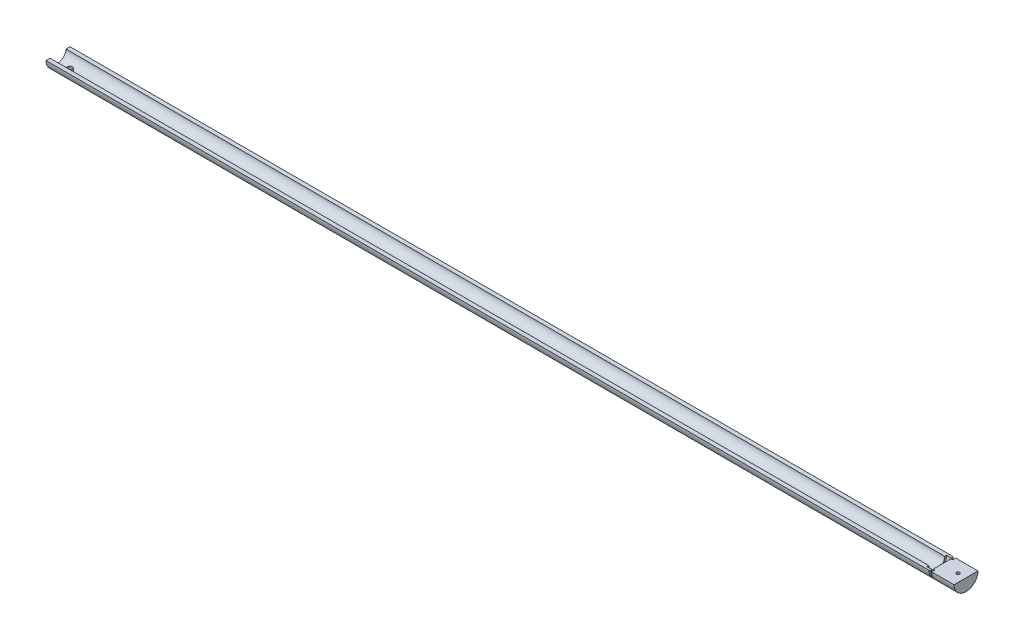
from build123d import *

# Parameters (mm, degrees)
SKETCH1_W             = 1803.4
SKETCH1_H             = 57.15
WOOD_BLOCK_DEPTH      = 28.575
SKETCH2_W             = 1755.775
SKETCH2_H             = 15.875
SKETCH9_W             = 10.541
SKETCH9_H             = 19.558
SKETCH5_R             = 6.3881
MOUTHPIECE_HOLE_DEPTH = 21.59
SKETCH6_R             = 3.175
DOWEL_PIN_HOLE_DEPTH  = 15.24
SKETCH8_R             = 8.128
MOUNTING_HOLES_DEPTH  = 10.3124
CHAMFER1_SIZE         = 16.7386
SKETCH3_OUTSIDE_W     = 420.056
SKETCH3_OUTSIDE_H     = 391.481
SKETCH3_OUTSIDE_R     = 23.8125
OUTER_DIAMETER_DEPTH  = 1805.531577305
SKETCH7_W             = 3.175
SKETCH7_H             = 6.35
CHAMFER_AT_FOOT_SIZE  = 1.905


with BuildPart() as part:
    # Sketch1 → wood block (new body)
    with BuildSketch(Plane(origin=(0, 0, 0), x_dir=(1, 0, 0), z_dir=(0, 1, 0))):
        with Locations((901.7, 28.575)):
            Rectangle(SKETCH1_W, SKETCH1_H)
    extrude(amount=WOOD_BLOCK_DEPTH)

    # Sketch2 → inner bore (revolve, cut)
    with BuildSketch(Plane.XY.offset(-28.575)):
        with Locations((877.8875, 20.6375)):
            Rectangle(SKETCH2_W, SKETCH2_H)
    revolve(axis=Axis((1755.775, 28.575, -28.575), (-1, 0, 0)), mode=Mode.SUBTRACT)

    # Sketch9 → flanged foot relief (revolve, cut)
    with BuildSketch(Plane.XY.offset(-28.575)):
        with Locations((1750.5045, 18.796)):
            Rectangle(SKETCH9_W, SKETCH9_H)
    revolve(axis=Axis((1755.775, 28.575, -28.575), (-1, 0, 0)), mode=Mode.SUBTRACT)

    # Sketch5 → mouthpiece hole (cut)
    with BuildSketch(Plane(origin=(0, 28.575, 0), x_dir=(1, 0, 0), z_dir=(0, 1, 0))):
        with Locations((22.225, 28.575)):
            Circle(SKETCH5_R)
    extrude(amount=-MOUTHPIECE_HOLE_DEPTH, mode=Mode.SUBTRACT)

    # Sketch6 → dowel pin hole (cut)
    with BuildSketch(Plane(origin=(0, 28.575, 0), x_dir=(1, 0, 0), z_dir=(0, 1, 0))):
        with Locations((1787.525, 28.575)):
            Circle(SKETCH6_R)
    extrude(amount=-DOWEL_PIN_HOLE_DEPTH, mode=Mode.SUBTRACT)

    # Sketch8 → mounting holes (cut)
    with BuildSketch(Plane.XZ):
        with Locations((22.225, -28.575)):
            Circle(SKETCH8_R)
        with Locations((713.359, -28.575)):
            Circle(SKETCH8_R)
    extrude(amount=-MOUNTING_HOLES_DEPTH, mode=Mode.SUBTRACT)

    # Chamfer1
    chamfer1_edges = [part.edges().sort_by_distance(p)[0] for p in [
        (901.7, 0, -57.15),
        (901.7, 0, 0),
    ]]
    chamfer(chamfer1_edges, length=CHAMFER1_SIZE)

    # Sketch3 outside → outer diameter (cut, through all)
    with BuildSketch(Plane(origin=(1803.4, 0, 0), x_dir=(0, 0, -1), z_dir=(1, 0, 0))):
        with Locations((28.575, 14.2875)):
            Rectangle(SKETCH3_OUTSIDE_W, SKETCH3_OUTSIDE_H)
        with Locations((28.575, 28.575)):
            Circle(SKETCH3_OUTSIDE_R, mode=Mode.SUBTRACT)
    extrude(amount=-OUTER_DIAMETER_DEPTH, mode=Mode.SUBTRACT)

    # Sketch7 → end length locator (revolve, cut)
    with BuildSketch(Plane(origin=(0, 28.575, 0), x_dir=(1, 0, 0), z_dir=(0, 1, 0))):
        with Locations((1757.3625, 7.9375)):
            Rectangle(SKETCH7_W, SKETCH7_H)
    revolve(axis=Axis((-15.875, 28.575, -28.575), (1, 0, 0)), mode=Mode.SUBTRACT)


with BuildPart() as end_length_locator_piece_1:
    # of the separate pieces the step leaves, piece 1, a body of its own (end_length_locator_pieces)
    add(part.part.solids().sort_by_distance((0, 28.575, -4.7625))[0])

    # Chamfer at foot
    chamfer_at_foot_edges = [end_length_locator_piece_1.edges().sort_by_distance(p)[0] for p in [
        (1755.775, 4.7625, -28.575),
    ]]
    chamfer(chamfer_at_foot_edges, length=CHAMFER_AT_FOOT_SIZE)


with BuildPart() as end_length_locator_piece_2:
    # of the separate pieces the step leaves, piece 2, a body of its own (end_length_locator_pieces)
    add(part.part.solids().sort_by_distance((1803.4, 28.575, -52.3875))[0])


solid = Compound([end_length_locator_piece_1.part, end_length_locator_piece_2.part])
